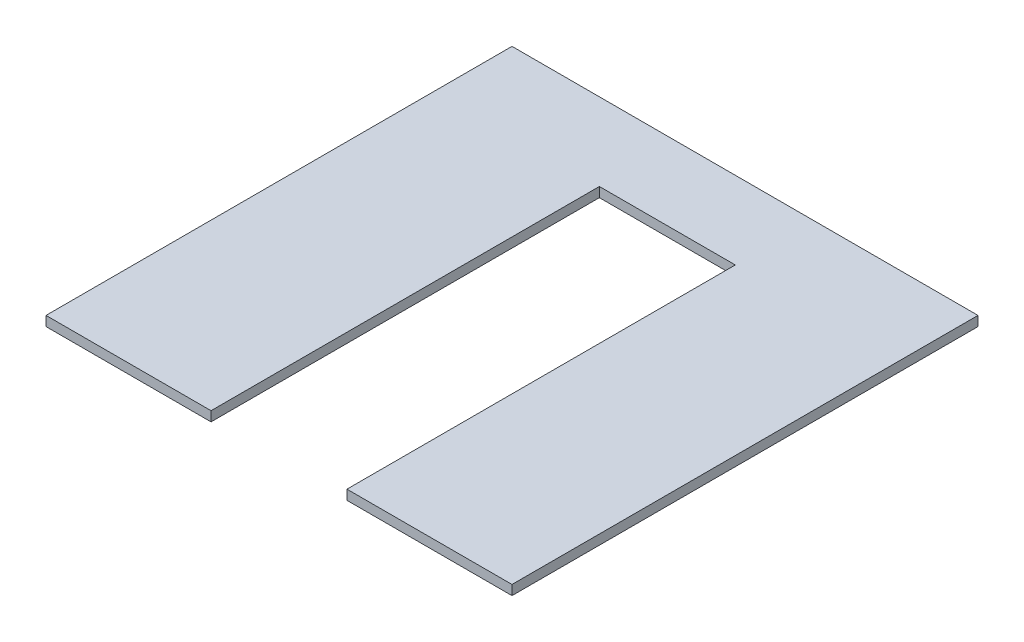
from build123d import *

# Parameters (mm, degrees)
BOSS_EXTRUDE1_DEPTH = 6.35


with BuildPart() as part:
    # Sketch1 → Boss-Extrude1 (new body)
    with BuildSketch(Plane(origin=(0, 0, 0), x_dir=(1, 0, 0), z_dir=(0, 1, 0))):
        Polygon((-152.4, 25.4), (-152.4, -279.4), (-44.45, -279.4), (-44.45, -25.4), (44.45, -25.4), (44.45, -279.4), (152.4, -279.4), (152.4, 25.4), align=None)
    extrude(amount=BOSS_EXTRUDE1_DEPTH)


solid = part.part
